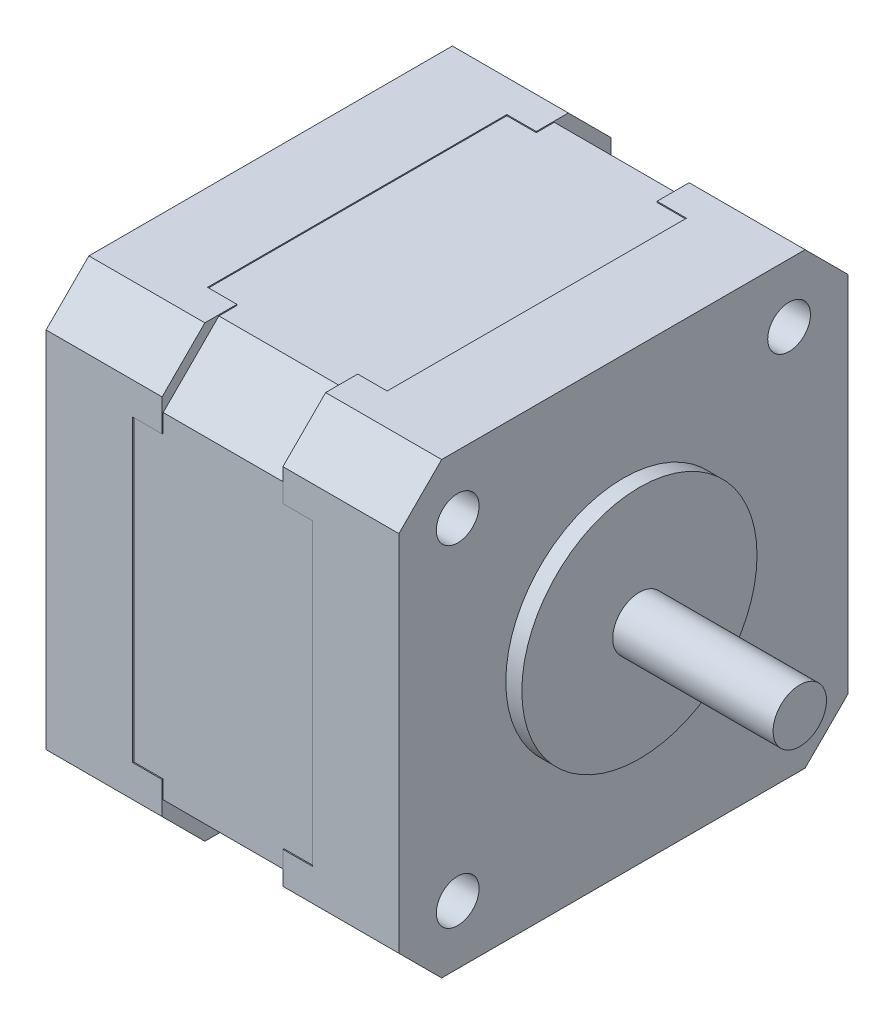
from build123d import *

# Parameters (mm, degrees)
CROQUIS1_W                  = 41.8
CROQUIS1_H                  = 41.8
SALIENTE_EXTRUIR1_DEPTH     = 11.3
CROQUIS2_W                  = 42
CROQUIS2_H                  = 41.9
SALIENTE_EXTRUIR2_DEPTH     = 10.85
CROQUIS3_W                  = 10.85
CROQUIS3_H                  = 42
SALIENTE_EXTRUIR3_DEPTH     = 0.1
CROQUIS4_W                  = 42
CROQUIS4_H                  = 42
SALIENTE_EXTRUIR4_DEPTH     = 10.85
CORTAR_EXTRUIR1_REACH       = 40.756
CROQUIS5_W                  = 0.1
CROQUIS5_H                  = 28
CORTAR_EXTRUIR2_REACH       = 40.756
CROQUIS6_W                  = 28
CROQUIS6_H                  = 0.1
CROQUIS7_W                  = 2.75
CROQUIS7_H                  = 28
CORTAR_EXTRUIR3_DEPTH       = 0.1
CROQUIS8_W                  = 2.75
CROQUIS8_H                  = 28
CORTAR_EXTRUIR4_DEPTH       = 0.1
CROQUIS9_W                  = 28
CROQUIS9_H                  = 0.1
CORTAR_EXTRUIR5_DEPTH       = 2.75
CROQUIS10_W                 = 2.75
CROQUIS10_H                 = 28
CORTAR_EXTRUIR6_DEPTH       = 0.1
CROQUIS11_W                 = 2.75
CROQUIS11_H                 = 28
CORTAR_EXTRUIR7_DEPTH       = 0.1
CROQUIS12_W                 = 2.75
CROQUIS12_H                 = 28
CORTAR_EXTRUIR8_DEPTH       = 0.1
CHAFL_N1_SIZE               = 5.214213562
CHAFL_N2_SIZE               = 4
CORTAR_EXTRUIR10_DEPTH      = 6
CORTAR_EXTRUIR10_DEPTH_BACK = 3
CROQUIS18_R                 = 2


with BuildPart() as part:
    # Croquis1 → Saliente-Extruir1 (new body)
    with BuildSketch(Plane(origin=(-5.65, 0, 0), x_dir=(0, -1, 0), z_dir=(-1, 0, 0))):
        Rectangle(CROQUIS1_W, CROQUIS1_H)
    extrude(amount=-SALIENTE_EXTRUIR1_DEPTH)

    # Croquis2 → Saliente-Extruir2 (add)
    with BuildSketch(Plane(origin=(5.65, 0, 0), x_dir=(0, 0, -1), z_dir=(1, 0, 0))):
        with Locations((0, -0.05)):
            Rectangle(CROQUIS2_W, CROQUIS2_H)
    extrude(amount=SALIENTE_EXTRUIR2_DEPTH)

    # Croquis3 → Saliente-Extruir3 (add)
    with BuildSketch(Plane(origin=(0, 20.9, 0), x_dir=(-1, 0, 0), z_dir=(0, 1, 0))):
        with Locations((-11.075, 0)):
            Rectangle(CROQUIS3_W, CROQUIS3_H)
    extrude(amount=SALIENTE_EXTRUIR3_DEPTH)

    # Croquis4 → Saliente-Extruir4 (add)
    with BuildSketch(Plane(origin=(-5.65, 0, 0), x_dir=(0, 0, -1), z_dir=(1, 0, 0))):
        Rectangle(CROQUIS4_W, CROQUIS4_H)
    extrude(amount=-SALIENTE_EXTRUIR4_DEPTH)

    # Croquis5 → Cortar-Extruir1 (cut, up to next)
    with BuildSketch(Plane(origin=(8.4, 0, 0), x_dir=(0, 0, -1), z_dir=(1, 0, 0)), mode=Mode.PRIVATE) as cortar_extruir1_sk1:
        with Locations((20.95, 0)):
            Rectangle(CROQUIS5_W, CROQUIS5_H)
    cortar_extruir1_tool1 = extrude(cortar_extruir1_sk1.sketch, amount=-CORTAR_EXTRUIR1_REACH, mode=Mode.PRIVATE) & part.part
    add(cortar_extruir1_tool1.solids().sort_by_distance((8.4, 0, -20.95))[0], mode=Mode.SUBTRACT)

    # Croquis6 → Cortar-Extruir2 (cut, up to next)
    with BuildSketch(Plane(origin=(-8.4, 0, 0), x_dir=(0, -1, 0), z_dir=(-1, 0, 0)), mode=Mode.PRIVATE) as cortar_extruir2_sk1:
        with Locations((0, 20.95)):
            Rectangle(CROQUIS6_W, CROQUIS6_H)
    cortar_extruir2_tool1 = extrude(cortar_extruir2_sk1.sketch, amount=-CORTAR_EXTRUIR2_REACH, mode=Mode.PRIVATE) & part.part
    add(cortar_extruir2_tool1.solids().sort_by_distance((-8.4, 0, 20.95))[0], mode=Mode.SUBTRACT)

    # Croquis7 → Cortar-Extruir3 (cut)
    with BuildSketch(Plane.XZ.offset(21)):
        with Locations((7.025, 0)):
            Rectangle(CROQUIS7_W, CROQUIS7_H)
    extrude(amount=-CORTAR_EXTRUIR3_DEPTH, mode=Mode.SUBTRACT)

    # Croquis8 → Cortar-Extruir4 (cut)
    with BuildSketch(Plane.XY.offset(21)):
        with Locations((7.025, 0)):
            Rectangle(CROQUIS8_W, CROQUIS8_H)
    extrude(amount=-CORTAR_EXTRUIR4_DEPTH, mode=Mode.SUBTRACT)

    # Croquis9 → Cortar-Extruir5 (cut)
    with BuildSketch(Plane.ZY.offset(-5.65)):
        with Locations((0, 20.95)):
            Rectangle(CROQUIS9_W, CROQUIS9_H)
    extrude(amount=-CORTAR_EXTRUIR5_DEPTH, mode=Mode.SUBTRACT)

    # Croquis10 → Cortar-Extruir6 (cut)
    with BuildSketch(Plane.XZ.offset(21)):
        with Locations((-7.025, 0)):
            Rectangle(CROQUIS10_W, CROQUIS10_H)
    extrude(amount=-CORTAR_EXTRUIR6_DEPTH, mode=Mode.SUBTRACT)

    # Croquis11 → Cortar-Extruir7 (cut)
    with BuildSketch(Plane(origin=(0, 0, -21), x_dir=(-1, 0, 0), z_dir=(0, 0, -1))):
        with Locations((7.025, 0)):
            Rectangle(CROQUIS11_W, CROQUIS11_H)
    extrude(amount=-CORTAR_EXTRUIR7_DEPTH, mode=Mode.SUBTRACT)

    # Croquis12 → Cortar-Extruir8 (cut)
    with BuildSketch(Plane(origin=(0, 21, 0), x_dir=(-1, 0, 0), z_dir=(0, 1, 0))):
        with Locations((7.025, 0)):
            Rectangle(CROQUIS12_W, CROQUIS12_H)
    extrude(amount=-CORTAR_EXTRUIR8_DEPTH, mode=Mode.SUBTRACT)

    # Croquis15 → Revolución1 (revolve)
    with BuildSketch(Plane.XY):
        Polygon((15.5, 11), (15.5, 0), (33, 0), (33, 2.5), (18, 2.5), (18, 11), align=None)
    revolve(axis=Axis((15.5, 0, 0), (1, 0, 0)))

    # Chaflán1
    chafl_n1_edges = [part.edges().sort_by_distance(p)[0] for p in [
        (0, -20.9, -20.9),
        (0, 20.9, 20.9),
        (0, 20.9, -20.9),
        (0, -20.9, 20.9),
    ]]
    chamfer(chafl_n1_edges, length=CHAFL_N1_SIZE)

    # Chaflán2
    chafl_n2_edges = [part.edges().sort_by_distance(p)[0] for p in [
        (-11.075, 21, -21),
        (-11.075, -21, 21),
        (11.075, -21, -21),
        (11.075, 21, -21),
        (-11.075, 21, 21),
        (11.075, 21, 21),
        (-11.075, -21, -21),
        (11.075, -21, 21),
    ]]
    chamfer(chafl_n2_edges, length=CHAFL_N2_SIZE)

    # Croquis18 → Cortar-Extruir10 (cut, two sides: drawn at the far end of the back side and taken through both)
    with BuildSketch(Plane(origin=(12.45, 0, 0), x_dir=(0, 0, -1), z_dir=(1, 0, 0)).offset(-CORTAR_EXTRUIR10_DEPTH_BACK)):
        with Locations((-15.5, 15.5)):
            Circle(CROQUIS18_R)
        with Locations((15.5, 15.5)):
            Circle(CROQUIS18_R)
        with Locations((15.5, -15.5)):
            Circle(CROQUIS18_R)
        with Locations((-15.5, -15.5)):
            Circle(CROQUIS18_R)
    extrude(amount=CORTAR_EXTRUIR10_DEPTH + CORTAR_EXTRUIR10_DEPTH_BACK, mode=Mode.SUBTRACT)


solid = part.part
